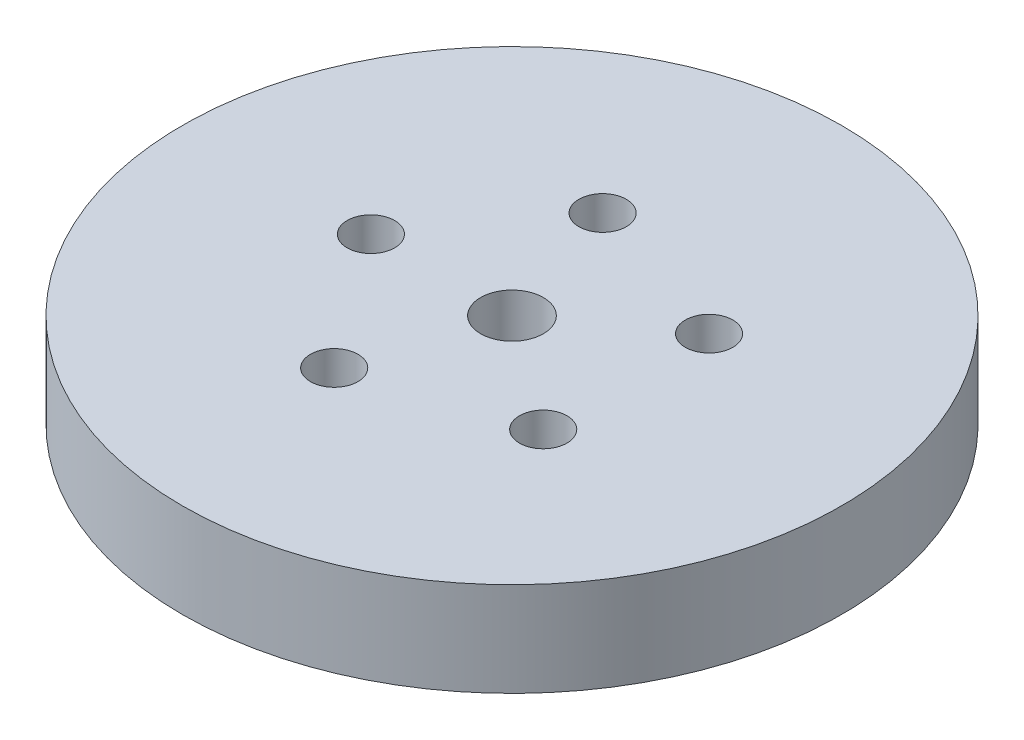
from build123d import *

# Parameters (mm, degrees)
SKETCH1_R           = 52.5
BOSS_EXTRUDE1_DEPTH = 15
SKETCH2_R           = 5
CUT_EXTRUDE1_DEPTH  = 76.746287038
SKETCH3_R           = 3.783086328
CUT_EXTRUDE2_DEPTH  = 12.483793899
CIRPATTERN1_COUNT   = 5


with BuildPart() as part:
    # Sketch1 → Boss-Extrude1 (new body)
    with BuildSketch(Plane(origin=(0, 0, 0), x_dir=(1, 0, 0), z_dir=(0, 1, 0))):
        Circle(SKETCH1_R)
    extrude(amount=BOSS_EXTRUDE1_DEPTH)

    # Sketch2 → Cut-Extrude1 (cut, through all)
    with BuildSketch(Plane(origin=(0, 0, 0), x_dir=(1, 0, 0), z_dir=(0, 1, 0))):
        Circle(SKETCH2_R)
    extrude(amount=CUT_EXTRUDE1_DEPTH, mode=Mode.SUBTRACT)

    # Sketch3 → Cut-Extrude2 (cut)
    with BuildSketch(Plane(origin=(0, 15, 0), x_dir=(1, 0, 0), z_dir=(0, 1, 0))):
        with Locations((-22.477539281, 0)):
            Circle(SKETCH3_R)
    cut_extrude2 = extrude(amount=-CUT_EXTRUDE2_DEPTH, mode=Mode.SUBTRACT)

    # CirPattern1: Cut-Extrude2 ×5 about axis
    cirpattern1_axis = Axis((0, 0, 0), (0, 1, 0))
    for i in range(1, CIRPATTERN1_COUNT):
        add(cut_extrude2.rotate(cirpattern1_axis, i * 360 / CIRPATTERN1_COUNT), mode=Mode.SUBTRACT)


solid = part.part
